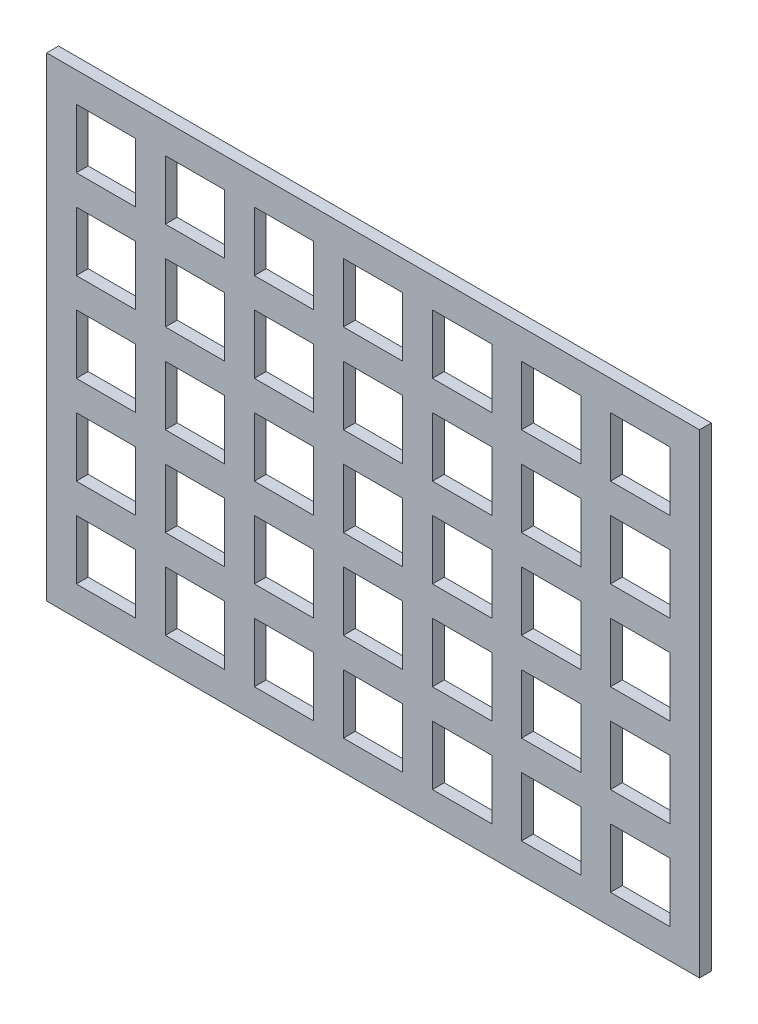
from build123d import *

# Parameters (mm, degrees)
SKETCH_1_W             = 21
SKETCH_1_H             = 1
EXTRUDE_1_DEPTH        = 0.4
PATTERN_LINEAR_1_COUNT = 6
PATTERN_LINEAR_1_PITCH = 3
EXTRUDE_3_DEPTH        = 0.4
PATTERN_LINEAR_2_COUNT = 8
PATTERN_LINEAR_2_PITCH = 3


with BuildPart() as part:
    # 草图1 → 凸台-拉伸1 (new body)
    with BuildSketch(Plane.XY):
        with Locations((10.5, 0.5)):
            Rectangle(SKETCH_1_W, SKETCH_1_H)
    extrude(amount=EXTRUDE_1_DEPTH)


with BuildPart() as pattern_linear_1_1:
    # 阵列(线性)1: pattern copy
    add(part.part.moved(Location(Vector(0, 1, 0) * (1 * PATTERN_LINEAR_1_PITCH))))


with BuildPart() as pattern_linear_1_2:
    # 阵列(线性)1: pattern copy
    add(part.part.moved(Location(Vector(0, 1, 0) * (2 * PATTERN_LINEAR_1_PITCH))))


with BuildPart() as pattern_linear_1_3:
    # 阵列(线性)1: pattern copy
    add(part.part.moved(Location(Vector(0, 1, 0) * (3 * PATTERN_LINEAR_1_PITCH))))


with BuildPart() as pattern_linear_1_4:
    # 阵列(线性)1: pattern copy
    add(part.part.moved(Location(Vector(0, 1, 0) * (4 * PATTERN_LINEAR_1_PITCH))))


with BuildPart() as pattern_linear_1_5:
    # 阵列(线性)1: pattern copy
    add(part.part.moved(Location(Vector(0, 1, 0) * (5 * PATTERN_LINEAR_1_PITCH))))


with BuildPart() as part_1:
    add(part.part)

    add(pattern_linear_1_1.part)  # 凸台-拉伸3 merges 阵列(线性)1_1

    add(pattern_linear_1_2.part)  # 凸台-拉伸3 merges 阵列(线性)1_2

    add(pattern_linear_1_3.part)  # 凸台-拉伸3 merges 阵列(线性)1_3
    # 草图3 → 凸台-拉伸3 (add)
    with BuildSketch(Plane.XY.offset(0.4)):
        Polygon((0, 16), (0, 10), (0, 0), (-1, 0), (-1, 10.98507125), (-1, 16), align=None)
    extrude_3 = extrude(amount=-EXTRUDE_3_DEPTH)

    # 阵列(线性)2: 凸台-拉伸3 ×8
    with Locations(*[(i * PATTERN_LINEAR_2_PITCH, 0, 0) for i in range(1, PATTERN_LINEAR_2_COUNT)]):
        add(extrude_3)

    # Combine 1: read off the stored shape, not the designer's step
    # Combine 1: union 阵列(线性)1_4, 阵列(线性)1_5
    add(pattern_linear_1_4.part)
    add(pattern_linear_1_5.part)


solid = part_1.part
